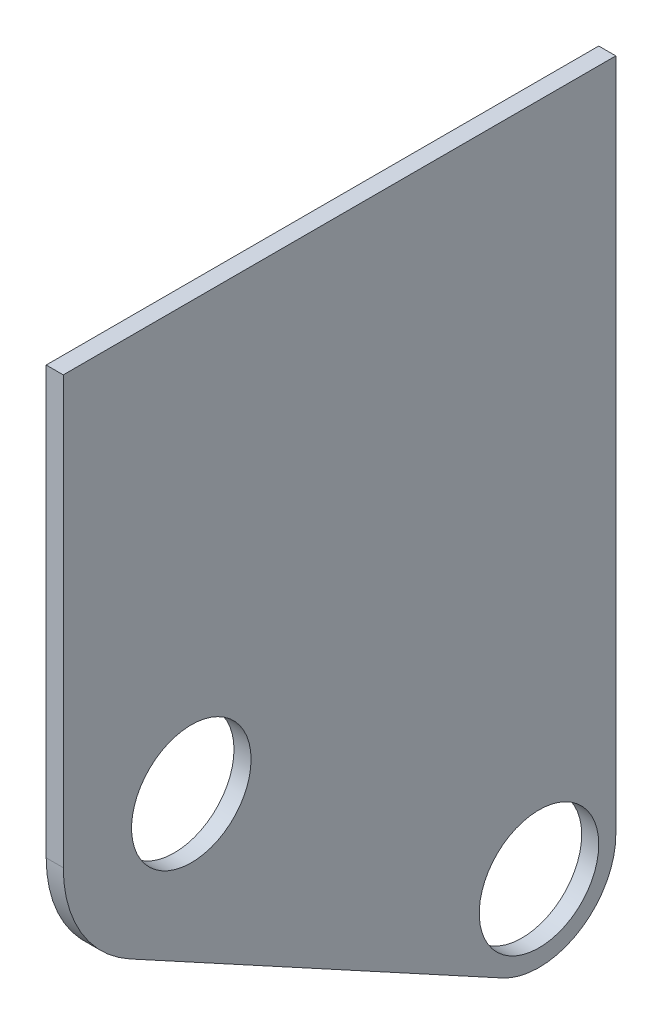
from build123d import *

# Parameters (mm, degrees)
SKETCH2_R           = 11.1125
BOSS_EXTRUDE1_DEPTH = 3.175


with BuildPart() as part:
    # Sketch2 → Boss-Extrude1 (new body)
    with BuildSketch(Plane(origin=(0, 0, 0), x_dir=(0, 0, -1), z_dir=(1, 0, 0))):
        with BuildLine():
            Line((51.380091319, 0), (-51.380091319, 0))
            Line((-51.380091319, 0), (-51.380091319, -79.375))
            ThreePointArc((-51.380091319, -79.375), (-48.038412992, -91.539728368), (-38.951273155, -100.290232346))
            Line((-38.951273155, -100.290232346), (30.262382217, -137.961639408))
            ThreePointArc((30.262382217, -137.961639408), (44.391428339, -137.694993004), (51.380091319, -125.4125))
            Line((51.380091319, -125.4125), (51.380091319, 0))
        make_face()
        with Locations((-27.567591319, -79.375)):
            Circle(SKETCH2_R, mode=Mode.SUBTRACT)
        with Locations((37.092591319, -125.4125)):
            Circle(SKETCH2_R, mode=Mode.SUBTRACT)
    extrude(amount=BOSS_EXTRUDE1_DEPTH)


solid = part.part
